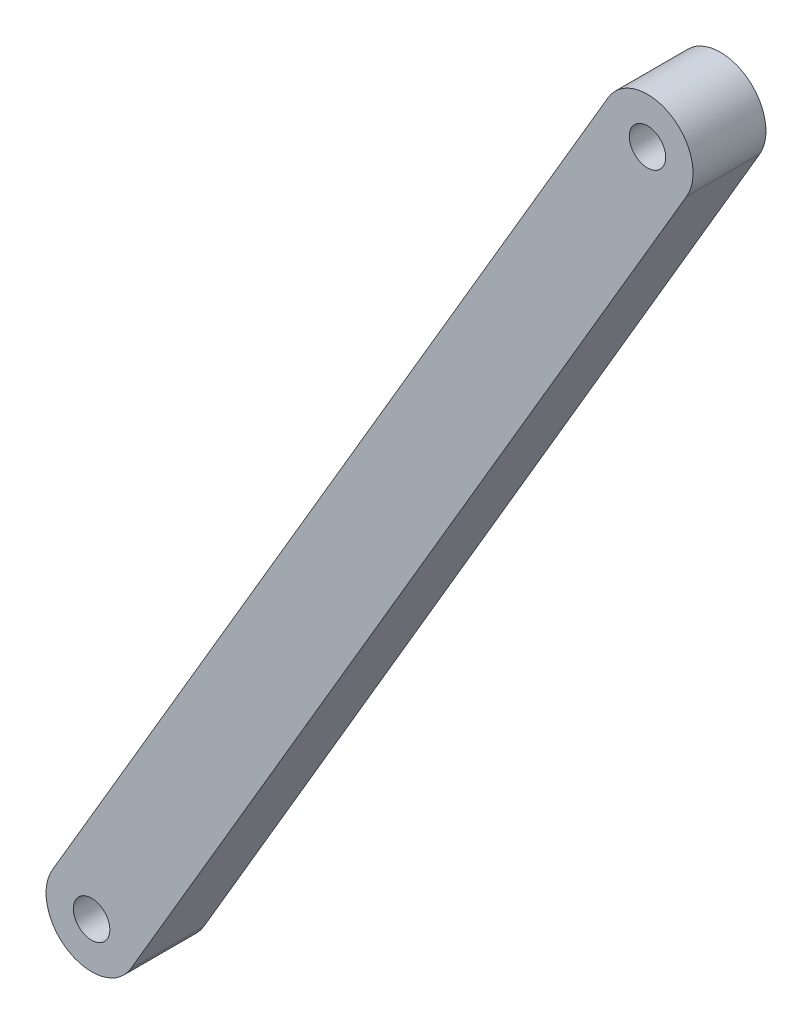
from build123d import *

# Parameters (mm, degrees)
AUFSATZ_LINEAR_AUSTRAGEN1_DEPTH      = 4
AUFSATZ_LINEAR_AUSTRAGEN1_DEPTH_BACK = 4
SKIZZE3_R                            = 2


with BuildPart() as part:
    # Skizze3 → Aufsatz-Linear austragen1 (new, two sides: drawn at the far end of the back side and taken through both)
    with BuildSketch(Plane.XY.offset(-AUFSATZ_LINEAR_AUSTRAGEN1_DEPTH_BACK)):
        with BuildLine():
            Line((24.688196798, 458.631472525), (85.688196798, 562.531472525))
            ThreePointArc((85.688196798, 562.531472525), (92.531472525, 564.311803202), (94.311803202, 557.468527475))
            Line((94.311803202, 557.468527475), (33.311803202, 453.568527475))
            ThreePointArc((33.311803202, 453.568527475), (26.468527475, 451.788196798), (24.688196798, 458.631472525))
        make_face()
        with Locations((90, 560)):
            Circle(SKIZZE3_R, mode=Mode.SUBTRACT)
        with Locations((29, 456.1)):
            Circle(SKIZZE3_R, mode=Mode.SUBTRACT)
    extrude(amount=AUFSATZ_LINEAR_AUSTRAGEN1_DEPTH + AUFSATZ_LINEAR_AUSTRAGEN1_DEPTH_BACK)


solid = part.part
